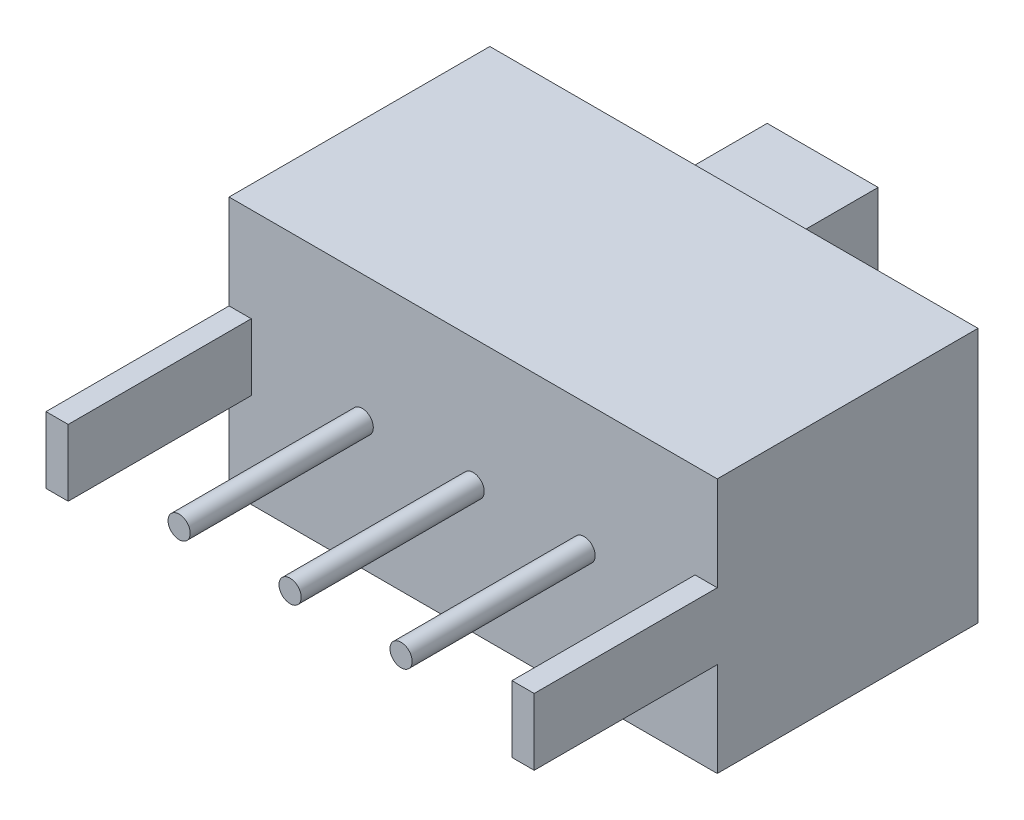
from build123d import *

# Parameters (mm, degrees)
SKETCH_1_W          = 8.8
SKETCH_1_H          = 4.6
EXTRUDE_1_DEPTH     = 4.7
SKETCH_1_3_W        = 4.2
SKETCH_1_3_H        = 2.2
SKETCH_1_3_W_2      = 2
SKETCH_1_3_H_2      = 2
CUT_EXTRUDE_1_DEPTH = 0.2
SKETCH_1_4_W        = 2
SKETCH_1_4_H        = 2
EXTRUDE_2_DEPTH     = 2.6
SKETCH_2_R          = 0.2
SKETCH_2_W          = 0.4
SKETCH_2_H          = 1.2
EXTRUDE_3_DEPTH     = 3.3


with BuildPart() as part:
    # 草图1 → 凸台-拉伸1 (new body)
    with BuildSketch(Plane.XY):
        with Locations((4.4, -2.3)):
            Rectangle(SKETCH_1_W, SKETCH_1_H)
    extrude(amount=EXTRUDE_1_DEPTH)

    # 草图1<3> → 切除-拉伸1 (cut)
    with BuildSketch(Plane.XY):
        with Locations((4.4, -2.3)):
            Rectangle(SKETCH_1_3_W, SKETCH_1_3_H)
        with Locations((3.4, -2.3)):
            Rectangle(SKETCH_1_3_W_2, SKETCH_1_3_H_2, mode=Mode.SUBTRACT)
    extrude(amount=CUT_EXTRUDE_1_DEPTH, mode=Mode.SUBTRACT)

    # 草图1<4> → 凸台-拉伸2 (add)
    with BuildSketch(Plane.XY):
        with Locations((3.4, -2.3)):
            Rectangle(SKETCH_1_4_W, SKETCH_1_4_H)
    extrude(amount=-EXTRUDE_2_DEPTH)

    # 草图2 → 凸台-拉伸3 (add)
    with BuildSketch(Plane.XY.offset(4.7)):
        with Locations((2.4, -2.3)):
            Circle(SKETCH_2_R)
        with Locations((4.4, -2.3)):
            Circle(SKETCH_2_R)
        with Locations((6.4, -2.3)):
            Circle(SKETCH_2_R)
        with Locations((8.6, -2.3)):
            Rectangle(SKETCH_2_W, SKETCH_2_H)
        with Locations((0.2, -2.3)):
            Rectangle(SKETCH_2_W, SKETCH_2_H)
    extrude(amount=EXTRUDE_3_DEPTH)


solid = part.part
